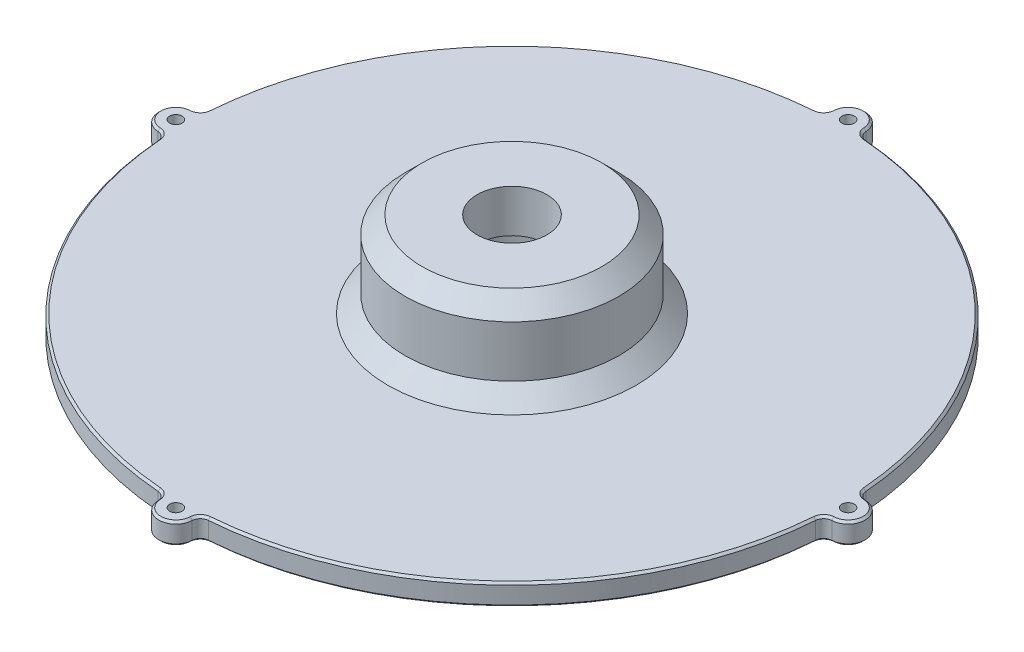
from build123d import *

# Parameters (mm, degrees)
SZKIC3_R                    = 1.45
DODANIE_WYCI_GNI_CIE1_DEPTH = 5
SFAZOWANIE1_SIZE            = 4
ZAOKR_GLENIE1_R             = 2
SFAZOWANIE2_SIZE            = 0.5


with BuildPart() as part:
    # Szkic2 → Obrót1 (revolve)
    with BuildSketch(Plane.XY):
        Polygon((77, 5), (25, 5), (25, 25), (8.15, 25), (8.15, 15), (15, 15), (15, 0), (77, 0), align=None)
    revolve(axis=Axis((0, 0, 0), (0, 1, 0)))

    # Szkic3 → Dodanie-wyciągnięcie1 (add)
    # profile 1 of 4: a face of its own
    with BuildSketch(Plane(origin=(0, 5, 0), x_dir=(1, 0, 0), z_dir=(0, 1, 0))):
        with BuildLine():
            Line((-4, 78.5), (-4, 76))
            ThreePointArc((-4, 76), (0, 72), (4, 76))
            Line((4, 76), (4, 78.5))
            ThreePointArc((4, 78.5), (0, 82.5), (-4, 78.5))
        make_face()
        with Locations((0, 78.5)):
            Circle(SZKIC3_R, mode=Mode.SUBTRACT)
    # profile 2 of 4: a face of its own
    with BuildSketch(Plane(origin=(0, 5, 0), x_dir=(1, 0, 0), z_dir=(0, 1, 0))):
        with BuildLine():
            Line((78.5, 4), (76, 4))
            ThreePointArc((76, 4), (72, 0), (76, -4))
            Line((76, -4), (78.5, -4))
            ThreePointArc((78.5, -4), (82.5, 0), (78.5, 4))
        make_face()
        with Locations((78.5, 0)):
            Circle(SZKIC3_R, mode=Mode.SUBTRACT)
    # profile 3 of 4: a face of its own
    with BuildSketch(Plane(origin=(0, 5, 0), x_dir=(1, 0, 0), z_dir=(0, 1, 0))):
        with BuildLine():
            Line((4, -78.5), (4, -76))
            ThreePointArc((4, -76), (0, -72), (-4, -76))
            Line((-4, -76), (-4, -78.5))
            ThreePointArc((-4, -78.5), (0, -82.5), (4, -78.5))
        make_face()
        with Locations((0, -78.5)):
            Circle(SZKIC3_R, mode=Mode.SUBTRACT)
    # profile 4 of 4: a face of its own
    with BuildSketch(Plane(origin=(0, 5, 0), x_dir=(1, 0, 0), z_dir=(0, 1, 0))):
        with BuildLine():
            Line((-78.5, -4), (-76, -4))
            ThreePointArc((-76, -4), (-72, 0), (-76, 4))
            Line((-76, 4), (-78.5, 4))
            ThreePointArc((-78.5, 4), (-82.5, 0), (-78.5, -4))
        make_face()
        with Locations((-78.5, 0)):
            Circle(SZKIC3_R, mode=Mode.SUBTRACT)
    extrude(amount=-DODANIE_WYCI_GNI_CIE1_DEPTH)

    # Sfazowanie1
    sfazowanie1_edges = [part.edges().sort_by_distance(p)[0] for p in [
        (-25, 5, 0),
        (-25, 25, 0),
    ]]
    chamfer(sfazowanie1_edges, length=SFAZOWANIE1_SIZE)

    # Zaokrąglenie1
    zaokr_glenie1_edges = [part.edges().sort_by_distance(p)[0] for p in [
        (76.896033708, 2.5, 4),
        (76.896033708, 2.5, -4),
        (4, 2.5, 76.896033708),
        (-4, 2.5, 76.896033708),
        (-76.896033708, 2.5, 4),
        (-76.896033708, 2.5, -4),
        (4, 2.5, -76.896033708),
        (-4, 2.5, -76.896033708),
    ]]
    fillet(zaokr_glenie1_edges, radius=ZAOKR_GLENIE1_R)

    # Sfazowanie2
    sfazowanie2_edges = [part.edges().sort_by_distance(p)[0] for p in [
        (-1.45, 0, -78.5),
        (77.05, 0, 0),
        (-1.45, 0, 78.5),
        (-79.95, 0, 0),
        (-15, 0, 0),
        (-82.5, 0, 0),
        (0, 0, 82.5),
        (82.5, 0, 0),
        (0, 0, -82.5),
        (-77.379843058, 0, 4.55817089),
        (-54.447222151, 0, 54.447222151),
        (-4.55817089, 0, 77.379843058),
        (4.55817089, 0, 77.379843058),
        (54.447222151, 0, 54.447222151),
        (77.379843058, 0, 4.55817089),
        (77.379843058, 0, -4.55817089),
        (54.447222151, 0, -54.447222151),
        (4.55817089, 0, -77.379843058),
        (-4.55817089, 0, -77.379843058),
        (-54.447222151, 0, -54.447222151),
        (-77.379843058, 0, -4.55817089),
        (54.447222151, 5, -54.447222151),
        (77.379843058, 5, -4.55817089),
        (4.55817089, 5, -77.379843058),
        (82.5, 5, 0),
        (0, 5, -82.5),
        (77.379843058, 5, 4.55817089),
        (-4.55817089, 5, -77.379843058),
        (54.447222151, 5, 54.447222151),
        (-54.447222151, 5, -54.447222151),
        (4.55817089, 5, 77.379843058),
        (-77.379843058, 5, -4.55817089),
        (0, 5, 82.5),
        (-82.5, 5, 0),
        (-4.55817089, 5, 77.379843058),
        (-77.379843058, 5, 4.55817089),
        (-54.447222151, 5, 54.447222151),
    ]]
    chamfer(sfazowanie2_edges, length=SFAZOWANIE2_SIZE)


solid = part.part
